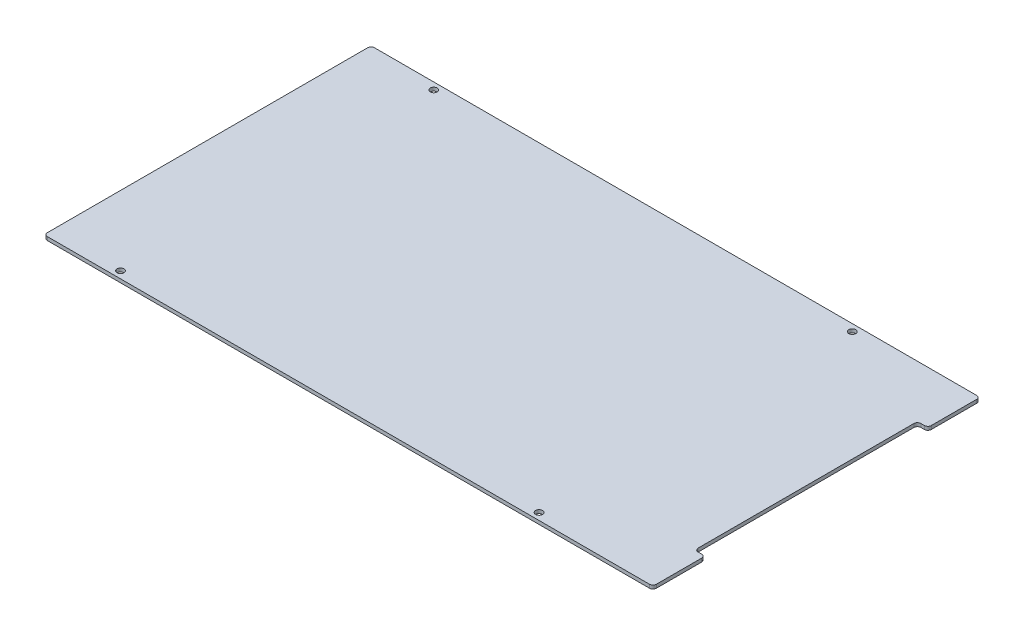
from build123d import *

# Parameters (mm, degrees)
SKETCH1_W                   = 555.625
SKETCH1_H                   = 298.45
BOSS_EXTRUDE1_DEPTH         = 3.175
SKETCH2_W                   = 9.525
SKETCH2_H                   = 203.2
CUT_EXTRUDE1_DEPTH          = 316.369571148
FILLET1_R                   = 3.175
F_1_4_0_25_DIAMETER_HOLE1_D = 6.35
FILLET2_R                   = 3.175


with BuildPart() as part:
    # Sketch1 → Boss-Extrude1 (new body)
    with BuildSketch(Plane(origin=(0, 0, 0), x_dir=(1, 0, 0), z_dir=(0, 1, 0))):
        Rectangle(SKETCH1_W, SKETCH1_H)
    extrude(amount=BOSS_EXTRUDE1_DEPTH)

    # Sketch2 → Cut-Extrude1 (cut, through all)
    with BuildSketch(Plane(origin=(0, 3.175, 0), x_dir=(1, 0, 0), z_dir=(0, 1, 0))):
        with Locations((273.05, 0)):
            Rectangle(SKETCH2_W, SKETCH2_H)
    extrude(amount=-CUT_EXTRUDE1_DEPTH, mode=Mode.SUBTRACT)

    # Fillet1
    fillet1_edges = [part.edges().sort_by_distance(p)[0] for p in [
        (268.2875, 1.5875, 101.6),
        (268.2875, 1.5875, -101.6),
    ]]
    fillet(fillet1_edges, radius=FILLET1_R)

    # 1/4 (0.25) Diameter Hole1 (through all)
    with Locations(Plane(origin=(0, 0, 0), x_dir=(-1, 0, 0), z_dir=(0, -1, 0))):
        with Locations((-167.5765, -142.875), (214.3125, -142.875)):
            f_1_4_0_25_diameter_hole1 = Hole(F_1_4_0_25_DIAMETER_HOLE1_D / 2)

    # Mirror1: 1/4 (0.25) Diameter Hole1 across plane
    add(f_1_4_0_25_diameter_hole1.mirror(Plane.XY), mode=Mode.SUBTRACT)

    # Fillet2
    fillet2_edges = [part.edges().sort_by_distance(p)[0] for p in [
        (277.8125, 1.5875, -101.6),
        (277.8125, 1.5875, 101.6),
        (277.8125, 1.5875, -149.225),
        (-277.8125, 1.5875, -149.225),
        (277.8125, 1.5875, 149.225),
        (-277.8125, 1.5875, 149.225),
    ]]
    fillet(fillet2_edges, radius=FILLET2_R)


solid = part.part
